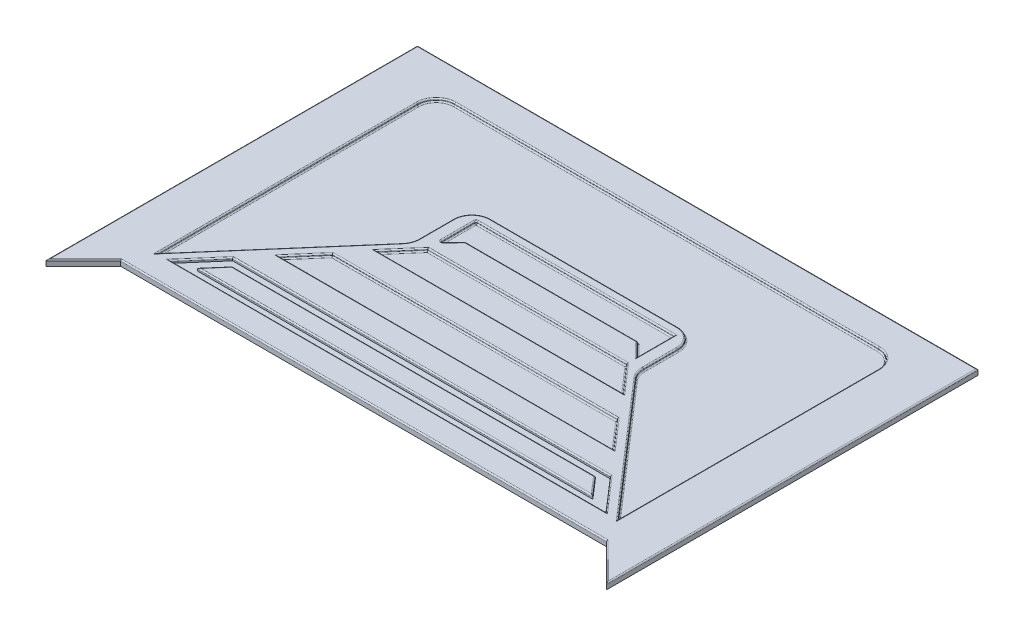
from build123d import *

# Parameters (mm, degrees)
BASE_FLANGE1_DEPTH = 11.43
CUT_EXTRUDE1_DEPTH = 5.842
CUT_EXTRUDE2_DEPTH = 5.842
BASE_FLANGE2_DEPTH = 5.842
CUT_EXTRUDE3_DEPTH = 5.842
FILLET1_R          = 2.54
FILLET2_R          = 2.54
FILLET3_R          = 2.54
FILLET4_R          = 2.54
FILLET5_R          = 2.54


# Sheet-metal steps are written as plain solids
with BuildPart() as part:
    # Sketch1 → Base-Flange1 (new body)
    with BuildSketch(Plane(origin=(0, 0, 0), x_dir=(1, 0, 0), z_dir=(0, 1, 0))):
        Polygon((0, 0), (0, 757.682), (1143, 757.682), (1143, 0), (1066.752571907, 76.152571907), (76.152571907, 76.152571907), align=None)
    extrude(amount=BASE_FLANGE1_DEPTH)

    # Sketch6 → Cut-Extrude1 (cut)
    with BuildSketch(Plane(origin=(0, 11.43, 0), x_dir=(1, 0, 0), z_dir=(0, 1, 0))):
        with BuildLine():
            Line((101.6, 656.082), (101.6, 125.682571907))
            Line((101.6, 125.682571907), (333.583764746, 393.18307912))
            ThreePointArc((333.583764746, 393.18307912), (340.495037728, 404.823200721), (342.9, 418.145148086))
            Line((342.9, 418.145148086), (342.9, 487.68))
            ThreePointArc((342.9, 487.68), (354.059231637, 514.620768363), (381, 525.78))
            Line((381, 525.78), (762, 525.78))
            ThreePointArc((762, 525.78), (788.940768363, 514.620768363), (800.1, 487.68))
            Line((800.1, 487.68), (800.1, 418.145148086))
            ThreePointArc((800.1, 418.145148086), (802.504962272, 404.823200721), (809.416235254, 393.18307912))
            Line((809.416235254, 393.18307912), (1041.4, 125.682571907))
            Line((1041.4, 125.682571907), (1041.4, 656.082))
            ThreePointArc((1041.4, 656.082), (1030.240768363, 683.022768363), (1003.3, 694.182))
            Line((1003.3, 694.182), (139.7, 694.182))
            ThreePointArc((139.7, 694.182), (112.759231637, 683.022768363), (101.6, 656.082))
        make_face()
    extrude(amount=-CUT_EXTRUDE1_DEPTH, mode=Mode.SUBTRACT)

    # Sketch8 → Cut-Extrude2 (cut)
    with BuildSketch(Plane(origin=(0, 11.43, 0), x_dir=(1, 0, 0), z_dir=(0, 1, 0))):
        Polygon((127, 125.894999192), (186.36374215, 194.347337452), (956.63625785, 194.347337452), (1016, 125.894999192), align=None)
    extrude(amount=-CUT_EXTRUDE2_DEPTH, mode=Mode.SUBTRACT)

    # Sketch12 → Cut-Extrude3 (cut)
    with BuildSketch(Plane(origin=(0, 11.43, 0), x_dir=(1, 0, 0), z_dir=(0, 1, 0))):
        Polygon((280.862041135, 303.313337452), (229.537790171, 244.131337452), (913.462209829, 244.131337452), (862.137958865, 303.313337452), align=None)
        Polygon((319.813506588, 353.097337452), (823.855365724, 353.097337452), (774.733872312, 409.739337452), (368.935, 409.739337452), align=None)
        Polygon((368.935, 507.909434387), (368.935, 431.709434387), (396.393706081, 459.523337452), (746.451248248, 459.523337452), (773.954852599, 431.709434387), (773.954852599, 507.909434387), align=None)
    extrude(amount=-CUT_EXTRUDE3_DEPTH, mode=Mode.SUBTRACT)

    # Fillet1
    fillet1_edges = [part.edges().sort_by_distance(p)[0] for p in [
        (571.444926299, 5.588, -507.909434387),
        (368.935, 8.509, -507.909434387),
        (773.954852599, 5.588, -469.809434387),
        (760.203050423, 5.588, -445.61638592),
        (571.422477165, 5.588, -459.523337452),
        (382.664353041, 5.588, -445.61638592),
        (368.935, 5.588, -469.809434387),
        (368.935, 8.509, -431.709434387),
        (571.444926299, 11.43, -507.909434387),
        (368.935, 11.43, -469.809434387),
        (382.664353041, 11.43, -445.61638592),
        (571.422477165, 11.43, -459.523337452),
        (760.203050423, 11.43, -445.61638592),
        (773.954852599, 11.43, -469.809434387),
    ]]
    fillet(fillet1_edges, radius=FILLET1_R)

    # Fillet2
    fillet2_edges = [part.edges().sort_by_distance(p)[0] for p in [
        (571.5, 5.588, -303.313337452),
        (887.800084347, 5.588, -273.722337452),
        (571.5, 5.588, -244.131337452),
        (255.199915653, 5.588, -273.722337452),
        (344.374253294, 5.588, -381.418337452),
        (571.834436156, 5.588, -409.739337452),
        (799.294619018, 5.588, -381.418337452),
        (571.834436156, 5.588, -353.097337452),
    ]]
    fillet(fillet2_edges, radius=FILLET2_R)

    # Fillet3
    fillet3_edges = [part.edges().sort_by_distance(p)[0] for p in [
        (217.591882373, 5.588, -259.432825513),
        (101.6, 5.588, -390.882285953),
        (112.759231637, 5.588, -683.022768363),
        (571.5, 5.588, -694.182),
        (1030.240768363, 5.588, -683.022768363),
        (1041.4, 5.588, -390.882285953),
        (925.408117627, 5.588, -259.432825513),
        (802.504962272, 5.588, -404.823200721),
        (800.1, 5.588, -452.912574043),
        (788.940768363, 5.588, -514.620768363),
        (571.5, 5.588, -525.78),
        (354.059231637, 5.588, -514.620768363),
        (342.9, 5.588, -452.912574043),
        (340.495037728, 5.588, -404.823200721),
    ]]
    fillet(fillet3_edges, radius=FILLET3_R)

    # Fillet5
    fillet5_edges = [part.edges().sort_by_distance(p)[0] for p in [
        (571.5, 11.43, -303.313337452),
        (255.199915653, 11.43, -273.722337452),
        (571.5, 11.43, -244.131337452),
        (887.800084347, 11.43, -273.722337452),
        (344.374253294, 11.43, -381.418337452),
        (571.834436156, 11.43, -353.097337452),
        (799.294619018, 11.43, -381.418337452),
        (571.834436156, 11.43, -409.739337452),
        (1104.876285953, 11.43, -38.076285953),
        (1143, 11.43, -378.841),
        (571.5, 11.43, -757.682),
        (0, 11.43, -378.841),
        (217.591882373, 11.43, -259.432825513),
        (340.495037728, 11.43, -404.823200721),
        (342.9, 11.43, -452.912574043),
        (354.059231637, 11.43, -514.620768363),
        (571.5, 11.43, -525.78),
        (788.940768363, 11.43, -514.620768363),
        (800.1, 11.43, -452.912574043),
        (802.504962272, 11.43, -404.823200721),
        (925.408117627, 11.43, -259.432825513),
        (1041.4, 11.43, -390.882285953),
        (1030.240768363, 11.43, -683.022768363),
        (571.5, 11.43, -694.182),
        (112.759231637, 11.43, -683.022768363),
        (101.6, 11.43, -390.882285953),
        (38.076285953, 11.43, -38.076285953),
        (571.5, 11.43, -125.894999192),
        (986.318128925, 11.43, -160.121168322),
        (571.5, 11.43, -194.347337452),
        (156.681871075, 11.43, -160.121168322),
        (571.452571907, 11.43, -76.152571907),
    ]]
    fillet(fillet5_edges, radius=FILLET5_R)


with BuildPart() as body_2:
    # Sketch9 → Base-Flange2 (new body)
    with BuildSketch(Plane(origin=(0, 5.588, 0), x_dir=(1, 0, 0), z_dir=(0, 1, 0))):
        Polygon((201.261651441, 178.572960564), (168.220288159, 140.472960564), (974.733472203, 140.472960564), (941.692108922, 178.572960564), align=None)
    extrude(amount=BASE_FLANGE2_DEPTH)

    # Fillet4
    fillet4_edges = [body_2.edges().sort_by_distance(p)[0] for p in [
        (571.476880181, 11.43, -140.472960564),
        (958.212790563, 11.43, -159.522960564),
        (571.476880181, 11.43, -178.572960564),
        (184.7409698, 11.43, -159.522960564),
    ]]
    fillet(fillet4_edges, radius=FILLET4_R)


solid = Compound([part.part, body_2.part])
